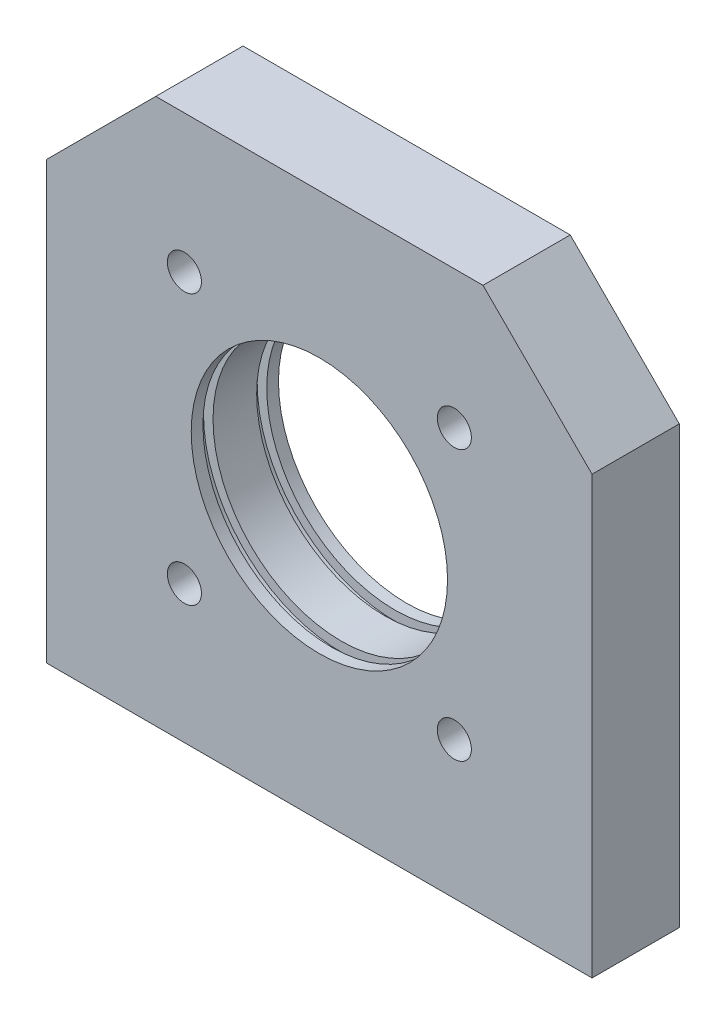
from build123d import *

# Parameters (mm, degrees)
SKETCH1_W                        = 100
SKETCH1_H                        = 100
BOSS_EXTRUDE1_DEPTH              = 16
CUT_EXTRUDE1_DEPTH               = 73.498275842
CUT_EXTRUDE1_DEPTH_BACK          = 73.498275842
SKETCH2_R                        = 23.5
SKETCH3_W                        = 1.85
SKETCH3_H                        = 1.75
TAP_DRILL_FOR_M6_HELICOIL1_D     = 6.25
TAP_DRILL_FOR_M6_HELICOIL1_DEPTH = 15
TAP_DRILL_FOR_M6_HELICOIL1_TIP   = 1.877689434
TAP_DRILL_FOR_M6_HELICOIL2_D     = 6.25
CHAMFER1_SIZE                    = 20


with BuildPart() as part:
    # Sketch1 → Boss-Extrude1 (new body)
    with BuildSketch(Plane.XY):
        Rectangle(SKETCH1_W, SKETCH1_H)
    extrude(amount=BOSS_EXTRUDE1_DEPTH)

    # Sketch2 → Cut-Extrude1 (cut, two sides: drawn at the far end of the back side and taken through both)
    with BuildSketch(Plane.XY.offset(16).offset(-CUT_EXTRUDE1_DEPTH_BACK)):
        Circle(SKETCH2_R)
    extrude(amount=CUT_EXTRUDE1_DEPTH + CUT_EXTRUDE1_DEPTH_BACK, mode=Mode.SUBTRACT)

    # Sketch3 → Cut-Revolve1 (revolve, cut)
    with BuildSketch(Plane(origin=(0, 0, 0), x_dir=(0, 0, -1), z_dir=(1, 0, 0))):
        with Locations((-3.075, 24.375)):
            Rectangle(SKETCH3_W, SKETCH3_H)
        with Locations((-12.925, 24.375)):
            Rectangle(SKETCH3_W, SKETCH3_H)
    revolve(axis=Axis((0, 0, 0), (0, 0, 1)), mode=Mode.SUBTRACT)

    # Tap Drill for M6 Helicoil1
    with Locations(Plane(origin=(0, -50, 0), x_dir=(-1, 0, 0), z_dir=(0, -1, 0))):
        with Locations((-40, -8), (0, -8), (40, -8)):
            Hole(TAP_DRILL_FOR_M6_HELICOIL1_D / 2, depth=TAP_DRILL_FOR_M6_HELICOIL1_DEPTH)
            with Locations((0, 0, -(TAP_DRILL_FOR_M6_HELICOIL1_DEPTH + TAP_DRILL_FOR_M6_HELICOIL1_TIP / 2))):  # 118° drill point
                Cone(0, TAP_DRILL_FOR_M6_HELICOIL1_D / 2, TAP_DRILL_FOR_M6_HELICOIL1_TIP, mode=Mode.SUBTRACT)

    # Tap Drill for M6 Helicoil2 (through all)
    with Locations(Plane(origin=(0, 0, 0), x_dir=(-1, 0, 0), z_dir=(0, 0, -1))):
        with Locations((-24.748737342, -24.748737342), (-24.748737342, 24.748737342), (24.748737342, 24.748737342), (24.748737342, -24.748737342)):
            Hole(TAP_DRILL_FOR_M6_HELICOIL2_D / 2)

    # Chamfer1
    chamfer1_edges = [part.edges().sort_by_distance(p)[0] for p in [
        (-50, 50, 8),
        (50, 50, 8),
    ]]
    chamfer(chamfer1_edges, length=CHAMFER1_SIZE)


solid = part.part
